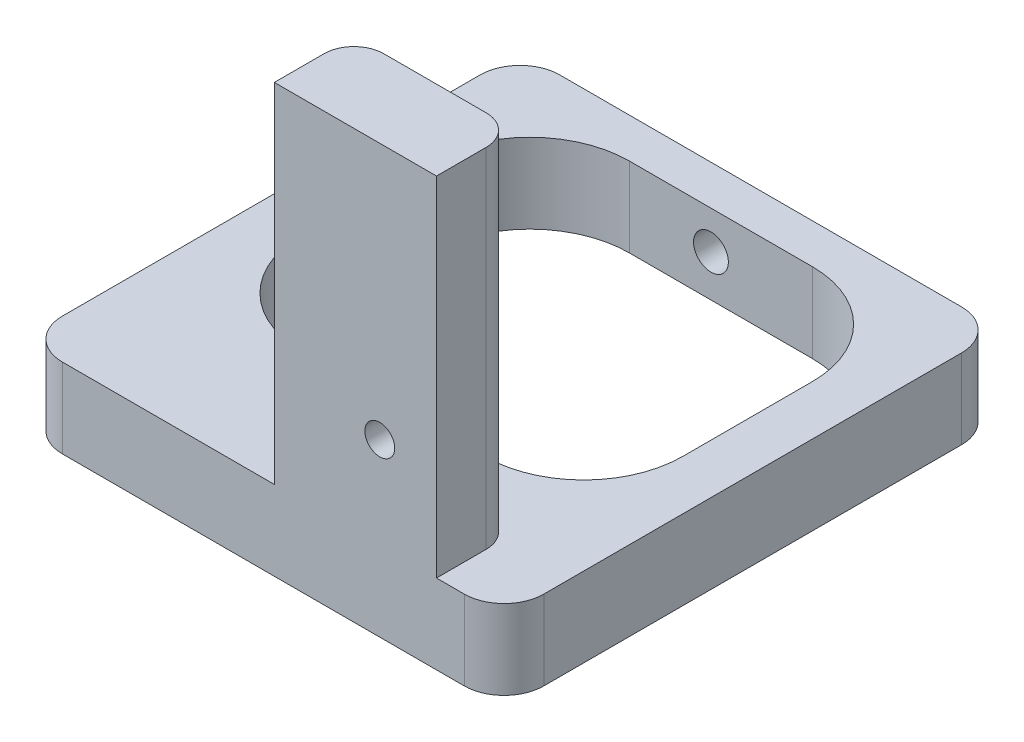
from build123d import *

# Parameters (mm, degrees)
SKETCH1_W           = 16.3
SKETCH1_H           = 35
SKETCH1_R           = 1.5
BOSS_EXTRUDE1_DEPTH = 8
SKETCH2_W           = 48.4
SKETCH2_H           = 50
BOSS_EXTRUDE2_DEPTH = 8
SKETCH3_R           = 1.75
CUT_EXTRUDE1_DEPTH  = 4
SKETCH4_R           = 1.75
CUT_EXTRUDE2_DEPTH  = 5
SKETCH5_R           = 3
CUT_EXTRUDE3_DEPTH  = 3.2
FILLET1_R           = 4
FILLET2_R           = 3


with BuildPart() as part:
    # Sketch1 → Boss-Extrude1 (new body)
    with BuildSketch(Plane.XY):
        with Locations((322.740686013, 351.682010011)):
            Rectangle(SKETCH1_W, SKETCH1_H)
        with Locations((325.190686013, 343.382010011)):
            Circle(SKETCH1_R, mode=Mode.SUBTRACT)
    extrude(amount=BOSS_EXTRUDE1_DEPTH)

    # Sketch2 → Boss-Extrude2 (add)
    with BuildSketch(Plane(origin=(0, 334.182010011, 0), x_dir=(-1, 0, 0), z_dir=(0, -1, 0))):
        with Locations((-313.481750966, 17)):
            Rectangle(SKETCH2_W, SKETCH2_H)
        with BuildLine():
            Line((-322.681750966, 38), (-304.281750966, 38))
            ThreePointArc((-304.281750966, 38), (-297.210683154, 35.071067812), (-294.281750966, 28))
            Line((-294.281750966, 28), (-294.281750966, 15))
            ThreePointArc((-294.281750966, 15), (-297.210683154, 7.928932188), (-304.281750966, 5))
            Line((-304.281750966, 5), (-322.681750966, 5))
            ThreePointArc((-322.681750966, 5), (-329.752818778, 7.928932188), (-332.681750966, 15))
            Line((-332.681750966, 15), (-332.681750966, 28))
            ThreePointArc((-332.681750966, 28), (-329.752818778, 35.071067812), (-322.681750966, 38))
        make_face(mode=Mode.SUBTRACT)
    extrude(amount=BOSS_EXTRUDE2_DEPTH)

    # Sketch3 → Cut-Extrude1 (cut)
    with BuildSketch(Plane(origin=(0, 0, -42), x_dir=(-1, 0, 0), z_dir=(0, 0, -1))):
        with Locations((-312.481750966, 330.362434358)):
            Circle(SKETCH3_R)
    extrude(amount=-CUT_EXTRUDE1_DEPTH, mode=Mode.SUBTRACT)

    # Sketch4 → Cut-Extrude2 (cut)
    with BuildSketch(Plane.ZY.offset(-289.281750966)):
        with Locations((-21, 330.202094394)):
            Circle(SKETCH4_R)
    extrude(amount=-CUT_EXTRUDE2_DEPTH, mode=Mode.SUBTRACT)

    # Sketch5 → Cut-Extrude3 (cut)
    with BuildSketch(Plane(origin=(0, 0, 0), x_dir=(-1, 0, 0), z_dir=(0, 0, -1))):
        with Locations((-325.190686013, 343.382010011)):
            Circle(SKETCH5_R)
    extrude(amount=-CUT_EXTRUDE3_DEPTH, mode=Mode.SUBTRACT)

    # Fillet1
    fillet1_edges = [part.edges().sort_by_distance(p)[0] for p in [
        (337.681750966, 330.182010011, -42),
        (337.681750966, 330.182010011, 8),
        (289.281750966, 330.182010011, 8),
        (289.281750966, 330.182010011, -42),
    ]]
    fillet(fillet1_edges, radius=FILLET1_R)

    # Fillet2
    # the kernel refuses this fillet: 3 mm, written as the material it takes off along each edge
    with BuildSketch(Plane(origin=(330.890686013, 376.682010011, 0), x_dir=(-1, 0, 0), z_dir=(0, -1, 0))) as fillet2_piece_1:
        with BuildLine():
            CenterArc((FILLET2_R, -FILLET2_R), FILLET2_R, 90, 90)
            Line((0, -FILLET2_R), (0, 0))
            Line((0, 0), (FILLET2_R, 0))
        make_face()
    extrude(amount=42.5, mode=Mode.SUBTRACT)
    with BuildSketch(Plane(origin=(314.590686013, 334.182010011, 0), x_dir=(0, 0, 1), z_dir=(0, 1, 0))) as fillet2_piece_2:
        with BuildLine():
            CenterArc((FILLET2_R, FILLET2_R), FILLET2_R, 180, 90)
            Line((0, FILLET2_R), (0, 0))
            Line((0, 0), (FILLET2_R, 0))
        make_face()
    extrude(amount=42.5, mode=Mode.SUBTRACT)


solid = part.part
